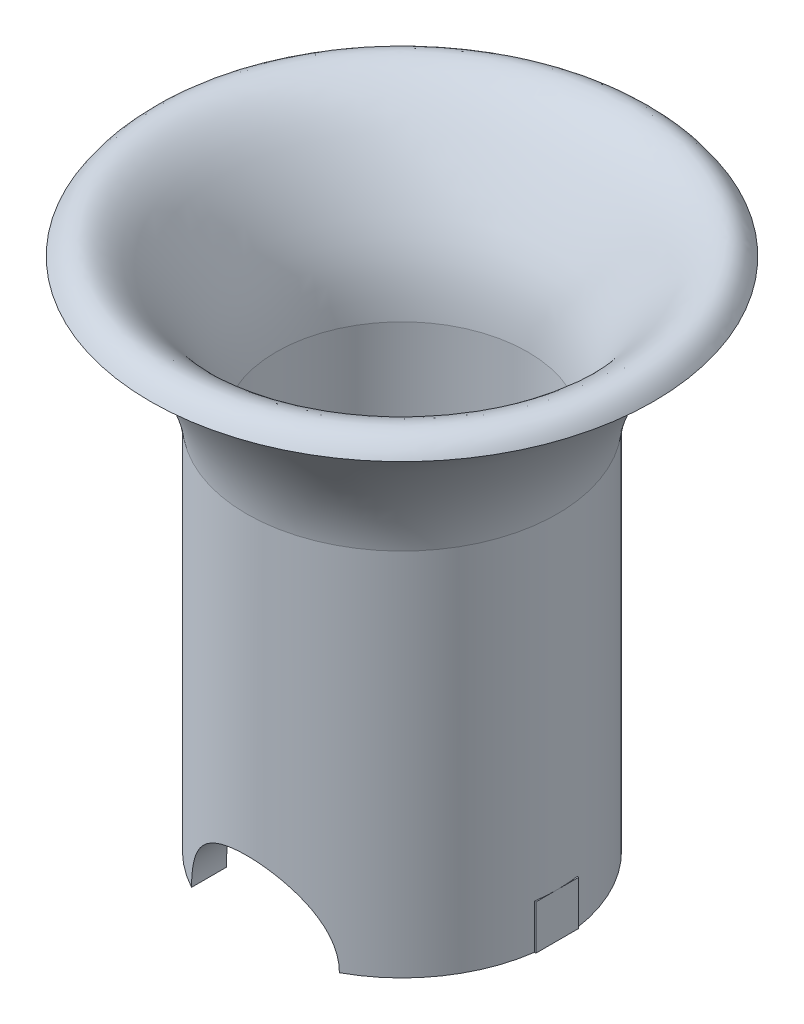
from build123d import *

# Parameters (mm, degrees)
BOSS_EXTRUDE1_DEPTH      = 1.45
BOSS_EXTRUDE1_DEPTH_BACK = 1.45
SKETCH3_W                = 13
SKETCH3_H                = 3
SKETCH3_R                = 0.5
SKETCH4_R                = 5
CUT_EXTRUDE1_DEPTH       = 20
FILLET1_R                = 2


with BuildPart() as part:
    # Sketch1 → Revolve1 (revolve)
    with BuildSketch(Plane.XY, mode=Mode.PRIVATE) as revolve1_sk:
        with BuildLine():
            Line((-8.5, 0), (-8.5, 25))
            add(Edge.make_bspline(
                [(-8.5, 25), (-8.597015347, 26.01504006), (-8.907000797, 27.967323593), (-10.203463046, 30.716511268), (-11.74686042, 33.10560974), (-13.777222786, 35.500816023), (-16.044814471, 36.474123076), (-17.015460227, 34.847167716)],
                knots=[0, 0, 0, 0, 0.199432853, 0.381102799, 0.589074274, 0.751073338, 1, 1, 1, 1], degree=3))
            add(Edge.make_bspline(
                [(-17.015460227, 34.847167716), (-15.061693604, 34.149149549), (-12.546917313, 30.799465382), (-10.772360994, 27.13941137), (-10.5, 25)],
                knots=[0, 0, 0, 0, 0.483303416, 1, 1, 1, 1], degree=3))
            Line((-10.5, 25), (-10.5, 0))
            Line((-10.5, 0), (-8.5, 0))
        make_face()
    revolve(revolve1_sk.sketch.rotate(Axis((0, 0, 0), (0, 1, 0)), 270), axis=Axis((0, 0, 0), (0, 1, 0)))

    # Sketch3 → Boss-Extrude1 (add, two sides: drawn at the far end of the back side and taken through both)
    with BuildSketch(Plane.XY.offset(-BOSS_EXTRUDE1_DEPTH_BACK)):
        with Locations((4, 1.5)):
            Rectangle(SKETCH3_W, SKETCH3_H)
        with Locations((0, 1.5)):
            Circle(SKETCH3_R, mode=Mode.SUBTRACT)
    extrude(amount=BOSS_EXTRUDE1_DEPTH + BOSS_EXTRUDE1_DEPTH_BACK)

    # Sketch4 → Cut-Extrude1 (cut)
    with BuildSketch(Plane.XY.offset(1.45)):
        Circle(SKETCH4_R)
    extrude(amount=CUT_EXTRUDE1_DEPTH, mode=Mode.SUBTRACT)

    # Fillet1
    # the kernel refuses this fillet: 2 mm, written as the material it takes off along each edge
    with BuildSketch(Plane(origin=(13.375410438, 3, -1.45), x_dir=(0, 0, 1), z_dir=(-1, 0, 0))) as fillet1_piece_1_section:
        with BuildLine():
            CenterArc((FILLET1_R, -FILLET1_R), FILLET1_R, 90, 90)
            Line((0, -FILLET1_R), (0, 0))
            Line((0, 0), (FILLET1_R, 0))
        make_face()
    fillet1_piece_1 = extrude(amount=20.875410438, mode=Mode.PRIVATE)
    fillet1_piece_1 = fillet1_piece_1 & Plane(origin=(0, 2.559869682, 0), x_dir=(0, 0, -1), z_dir=(0, 1, 0)) * Cylinder(8.5, 50, mode=Mode.PRIVATE)
    add(fillet1_piece_1, mode=Mode.SUBTRACT)
    with BuildSketch(Plane(origin=(-7.5, 3, 1.45), x_dir=(0, -1, 0), z_dir=(1, 0, 0))) as fillet1_piece_2_section:
        with BuildLine():
            CenterArc((FILLET1_R, FILLET1_R), FILLET1_R, 180, 90)
            Line((0, FILLET1_R), (0, 0))
            Line((0, 0), (FILLET1_R, 0))
        make_face()
    fillet1_piece_2 = extrude(amount=20.875410438, mode=Mode.PRIVATE)
    fillet1_piece_2 = fillet1_piece_2 & Plane(origin=(0, 2.559861322, 0), x_dir=(0, 0, -1), z_dir=(0, 1, 0)) * Cylinder(8.5, 50, mode=Mode.PRIVATE)
    add(fillet1_piece_2, mode=Mode.SUBTRACT)


solid = part.part
